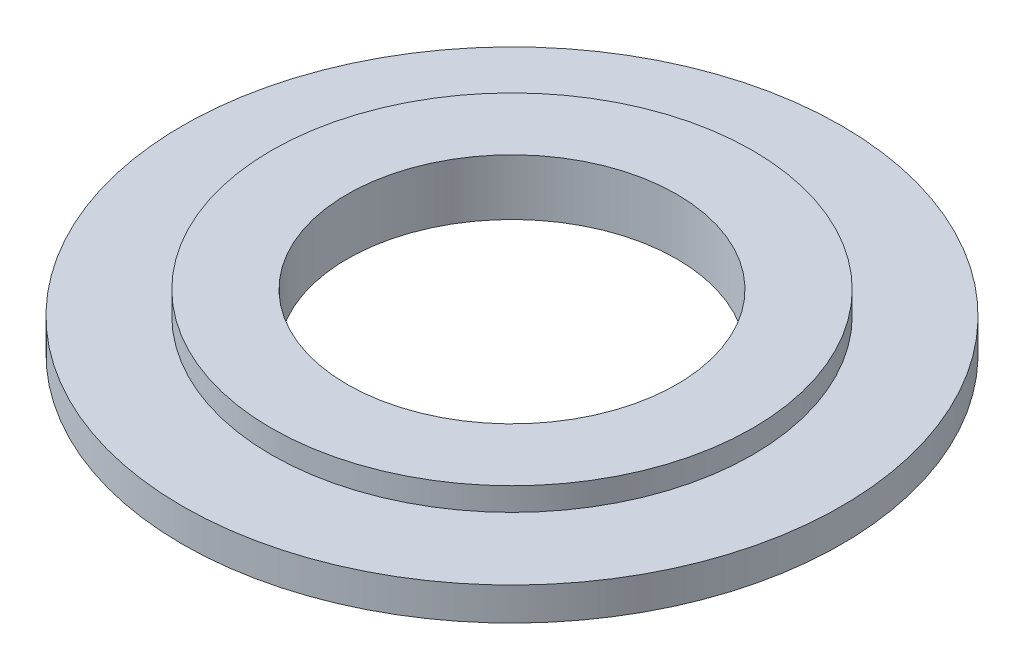
from build123d import *

# Parameters (mm, degrees)
SKETCH1_R           = 10
SKETCH1_R_2         = 5
BOSS_EXTRUDE1_DEPTH = 1
BOSS_EXTRUDE2_START = 0.7
SKETCH1_3_R         = 7.3
SKETCH1_3_R_2       = 5
BOSS_EXTRUDE2_DEPTH = 0.7


with BuildPart() as part:
    # Sketch1 → Boss-Extrude1 (new body)
    with BuildSketch(Plane(origin=(0, 0, 0), x_dir=(1, 0, 0), z_dir=(0, 1, 0))):
        Circle(SKETCH1_R)
        Circle(SKETCH1_R_2, mode=Mode.SUBTRACT)
    extrude(amount=-BOSS_EXTRUDE1_DEPTH)

    # Sketch1<3> → Boss-Extrude2 (add)
    with BuildSketch(Plane(origin=(0, 0, 0), x_dir=(1, 0, 0), z_dir=(0, 1, 0)).offset(BOSS_EXTRUDE2_START)):
        Circle(SKETCH1_3_R)
        Circle(SKETCH1_3_R_2, mode=Mode.SUBTRACT)
    extrude(amount=-BOSS_EXTRUDE2_DEPTH)


solid = part.part
